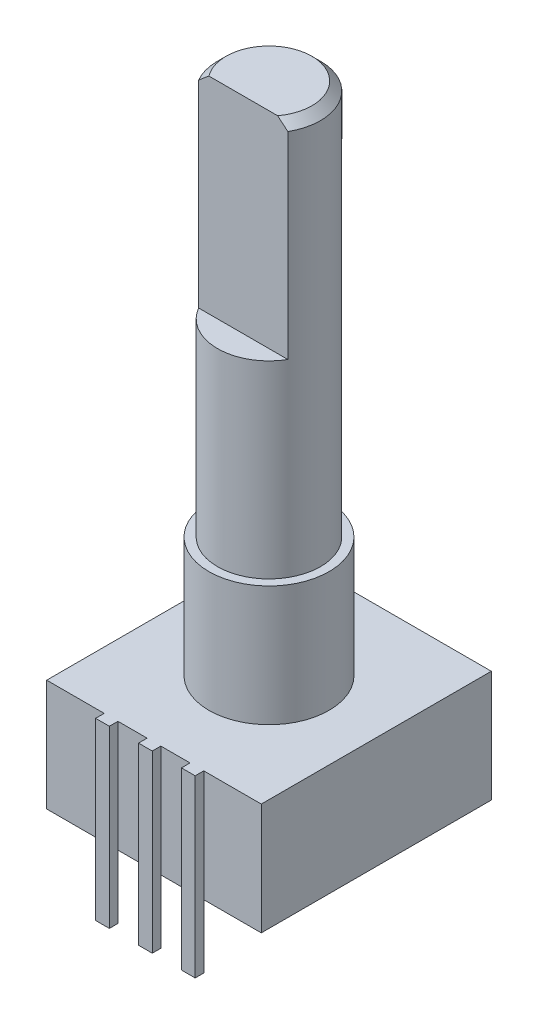
from build123d import *

# Parameters (mm, degrees)
SKETCH1_W           = 12.5
SKETCH1_H           = 13.4
BOSS_EXTRUDE1_DEPTH = 6.5
SKETCH2_R           = 3.5
BOSS_EXTRUDE2_DEPTH = 7
SKETCH3_R           = 3
BOSS_EXTRUDE3_DEPTH = 23
CHAMFER1_SIZE       = 0.5
CUT_EXTRUDE1_START  = -12
CUT_EXTRUDE1_DEPTH  = 12
SKETCH5_W           = 0.8
SKETCH5_H           = 10.2
BOSS_EXTRUDE4_DEPTH = 0.5


with BuildPart() as part:
    # Sketch1 → Boss-Extrude1 (new body)
    with BuildSketch(Plane(origin=(0, 0, 0), x_dir=(1, 0, 0), z_dir=(0, 1, 0))):
        Rectangle(SKETCH1_W, SKETCH1_H)
    extrude(amount=-BOSS_EXTRUDE1_DEPTH)

    # Sketch2 → Boss-Extrude2 (add)
    with BuildSketch(Plane(origin=(0, 0, 0), x_dir=(1, 0, 0), z_dir=(0, 1, 0))):
        Circle(SKETCH2_R)
    extrude(amount=BOSS_EXTRUDE2_DEPTH)

    # Sketch3 → Boss-Extrude3 (add)
    with BuildSketch(Plane(origin=(0, 7, 0), x_dir=(1, 0, 0), z_dir=(0, 1, 0))):
        Circle(SKETCH3_R)
    extrude(amount=BOSS_EXTRUDE3_DEPTH)

    # Chamfer1
    chamfer1_edges = [part.edges().sort_by_distance(p)[0] for p in [
        (-3, 30, 0),
    ]]
    chamfer(chamfer1_edges, length=CHAMFER1_SIZE)

    # Sketch4 → Cut-Extrude1 (cut)
    with BuildSketch(Plane(origin=(0, 30, 0), x_dir=(1, 0, 0), z_dir=(0, 1, 0)).offset(CUT_EXTRUDE1_START)):
        with BuildLine():
            Line((-2.598076211, -1.5), (2.598076211, -1.5))
            ThreePointArc((2.598076211, -1.5), (0, -3), (-2.598076211, -1.5))
        make_face()
    extrude(amount=CUT_EXTRUDE1_DEPTH, mode=Mode.SUBTRACT)

    # Sketch5 → Boss-Extrude4 (add)
    with BuildSketch(Plane.XY.offset(6.7)):
        with Locations((-2.5, -5.1)):
            Rectangle(SKETCH5_W, SKETCH5_H)
        with Locations((0, -5.1)):
            Rectangle(SKETCH5_W, SKETCH5_H)
        with Locations((2.5, -5.1)):
            Rectangle(SKETCH5_W, SKETCH5_H)
    extrude(amount=BOSS_EXTRUDE4_DEPTH)


solid = part.part
